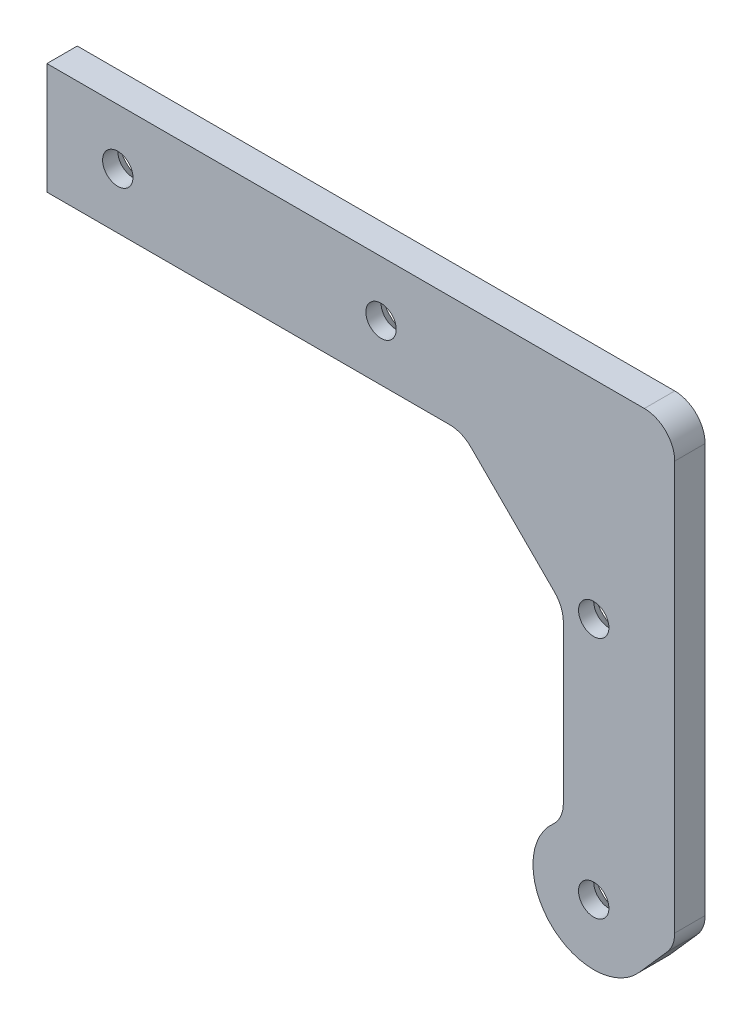
from build123d import *

# Parameters (mm, degrees)
SKETCH_1_R        = 1.5
EXTRUDE_918_DEPTH = 3
FILLET1_R         = 3
CHAMFER_1246_SIZE = 1.5


with BuildPart() as part:
    # Эскиз1 → Extrude 918 (new body)
    with BuildSketch(Plane.XY):
        with BuildLine():
            Line((-56.5, 5.5), (-56.5, -5.5))
            Line((-56.5, -5.5), (-15.5, -5.5))
            Line((-15.5, -5.5), (-5.5, -15.5))
            Line((-5.5, -15.5), (-5.5, -33.803847577))
            ThreePointArc((-5.5, -33.803847577), (-7.143360347, -42.799895352), (2, -42.968626967))
            Line((2, -42.968626967), (5.5, -39))
            Line((5.5, -39), (5.5, 5.5))
            Line((5.5, 5.5), (-56.5, 5.5))
        make_face()
        with Locations((-23.5, 0)):
            Circle(SKETCH_1_R, mode=Mode.SUBTRACT)
        with Locations((-49.5, 0)):
            Circle(SKETCH_1_R, mode=Mode.SUBTRACT)
        with Locations((-2.5, -15)):
            Circle(SKETCH_1_R, mode=Mode.SUBTRACT)
        with Locations((-2.5, -39)):
            Circle(SKETCH_1_R, mode=Mode.SUBTRACT)
    extrude(amount=EXTRUDE_918_DEPTH)

    # Fillet1
    fillet1_edges = [part.edges().sort_by_distance(p)[0] for p in [
        (5.5, 5.5, 1.5),
        (5.5, -39, 1.5),
        (-5.5, -33.803847577, 1.5),
        (-5.5, -15.5, 1.5),
        (-15.5, -5.5, 1.5),
    ]]
    fillet(fillet1_edges, radius=FILLET1_R)

    # Chamfer 1246
    chamfer_1246_edges = [part.edges().sort_by_distance(p)[0] for p in [
        (-51, 0, 0),
        (-25, 0, 0),
        (-4, -15, 0),
        (-4, -39, 0),
    ]]
    chamfer(chamfer_1246_edges, length=CHAMFER_1246_SIZE)


solid = part.part
